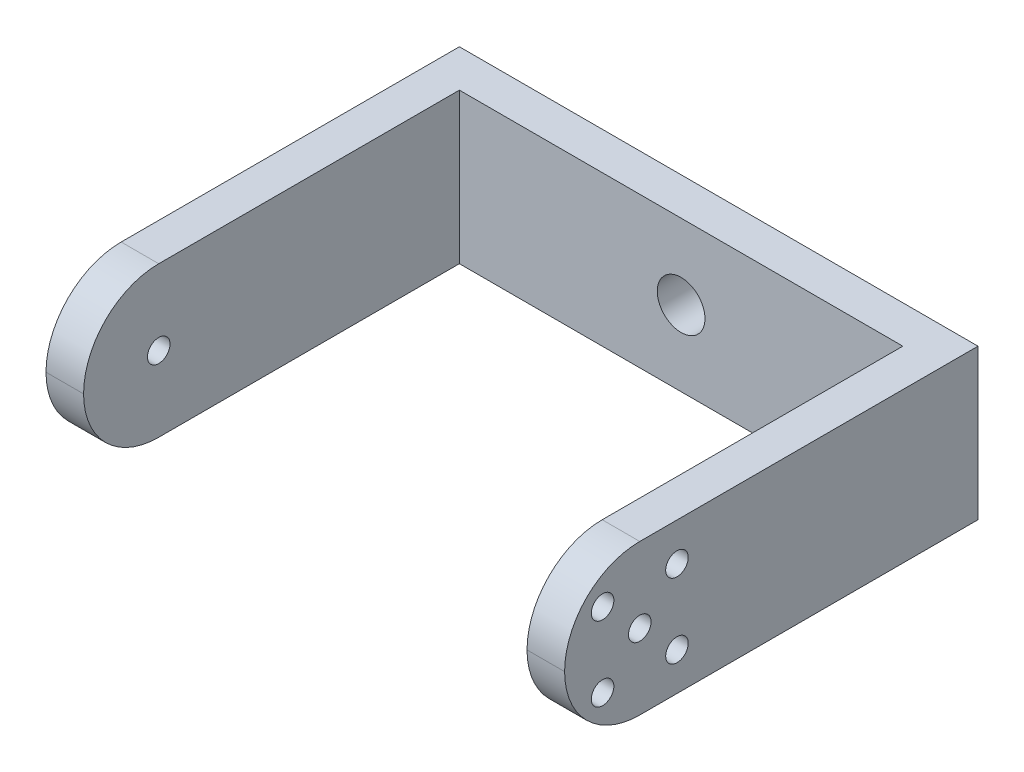
from build123d import *

# Parameters (mm, degrees)
SKETCH_1_W          = 69
SKETCH_1_H          = 20
EXTRUDE_1_DEPTH     = 5
SKETCH_2_W          = 5
SKETCH_2_H          = 20
EXTRUDE_2_DEPTH     = 50
FILLET_1_R          = 10
SKETCH_3_R          = 1.5
CUT_EXTRUDE_1_DEPTH = 82
SKETCH_4_R          = 1.5
CUT_EXTRUDE_2_DEPTH = 10
SKETCH_5_R          = 3.175
CUT_EXTRUDE_3_DEPTH = 10


with BuildPart() as part:
    # 草图1 → 凸台-拉伸1 (new body)
    with BuildSketch(Plane.XY):
        Rectangle(SKETCH_1_W, SKETCH_1_H)
    extrude(amount=EXTRUDE_1_DEPTH)

    # 草图2 → 凸台-拉伸2 (add)
    with BuildSketch(Plane.XY.offset(5)):
        with Locations((-32, 0)):
            Rectangle(SKETCH_2_W, SKETCH_2_H)
        with Locations((32, 0)):
            Rectangle(SKETCH_2_W, SKETCH_2_H)
    extrude(amount=EXTRUDE_2_DEPTH)

    # 圆角1
    fillet_1_edges = [part.edges().sort_by_distance(p)[0] for p in [
        (-32, -10, 55),
        (-32, 10, 55),
        (32, 10, 55),
        (32, -10, 55),
    ]]
    fillet(fillet_1_edges, radius=FILLET_1_R - 0.0001)  # a hair under: the kernel refuses the full size

    # 草图3 → 切除-拉伸1 (cut)
    with BuildSketch(Plane(origin=(34.5, 0, 0), x_dir=(0, 0, -1), z_dir=(1, 0, 0))):
        with Locations((-45, 0)):
            Circle(SKETCH_3_R)
    extrude(amount=-CUT_EXTRUDE_1_DEPTH, mode=Mode.SUBTRACT)

    # 草图4 → 切除-拉伸2 (cut)
    with BuildSketch(Plane(origin=(34.5, 0, 0), x_dir=(0, 0, -1), z_dir=(1, 0, 0))):
        with Locations((-49.949747468, 4.949747468)):
            Circle(SKETCH_4_R)
        with Locations((-40.050252532, 4.949747468)):
            Circle(SKETCH_4_R)
        with Locations((-40.050252532, -4.949747468)):
            Circle(SKETCH_4_R)
        with Locations((-49.949747468, -4.949747468)):
            Circle(SKETCH_4_R)
    extrude(amount=-CUT_EXTRUDE_2_DEPTH, mode=Mode.SUBTRACT)

    # 草图5 → 切除-拉伸3 (cut)
    with BuildSketch(Plane(origin=(0, 0, 0), x_dir=(-1, 0, 0), z_dir=(0, 0, -1))):
        Circle(SKETCH_5_R)
    extrude(amount=-CUT_EXTRUDE_3_DEPTH, mode=Mode.SUBTRACT)


solid = part.part
